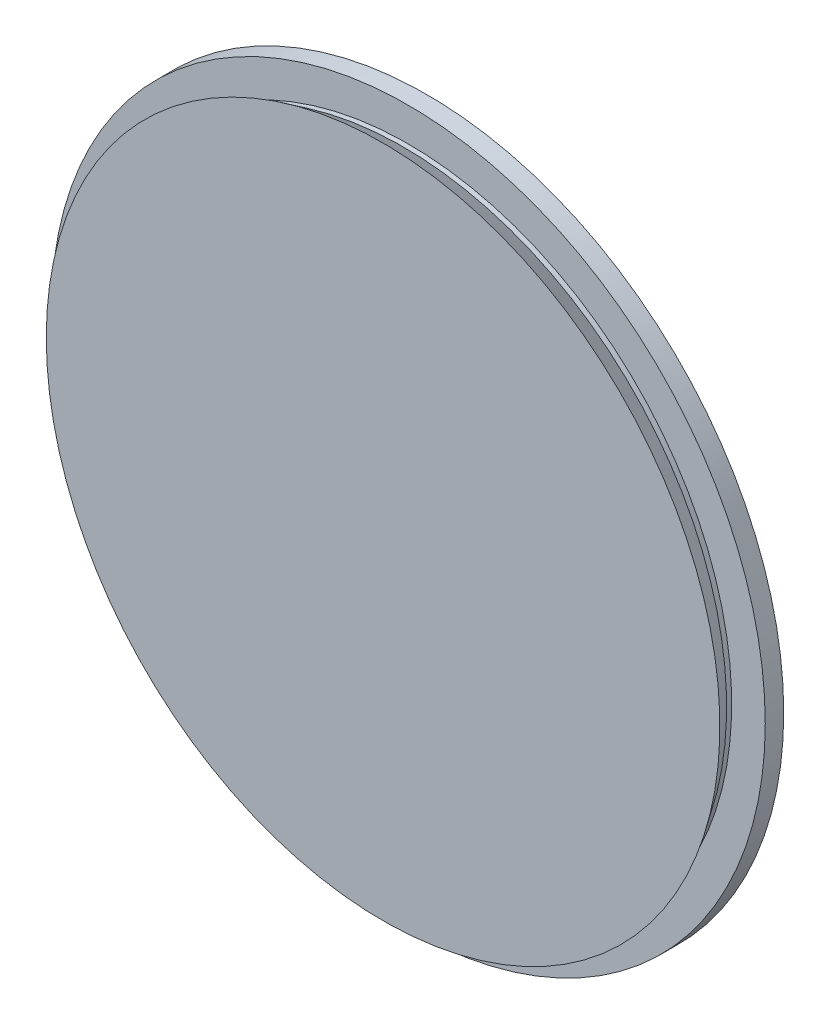
from build123d import *

# Parameters (mm, degrees)
SKETCH1_R           = 19.25
BOSS_EXTRUDE1_DEPTH = 2.6
SKETCH2_R           = 21.25
SKETCH2_R_2         = 19.25
BOSS_EXTRUDE2_DEPTH = 1.1


with BuildPart() as part:
    # Sketch1 → Boss-Extrude1 (new body)
    with BuildSketch(Plane.XY):
        Circle(SKETCH1_R)
    extrude(amount=BOSS_EXTRUDE1_DEPTH)

    # Sketch2 → Boss-Extrude2 (add)
    with BuildSketch(Plane(origin=(0, 0, 0), x_dir=(-1, 0, 0), z_dir=(0, 0, -1))):
        Circle(SKETCH2_R)
        Circle(SKETCH2_R_2, mode=Mode.SUBTRACT)
    extrude(amount=-BOSS_EXTRUDE2_DEPTH)

    # Sweep1: sweep along a path in Sketch4
    with BuildLine(Plane.XY.offset(2.6)) as sweep1_path:
        CenterArc((0, 0), 19.25, 0, 360)
    # Sketch3 → Sweep1 (sweep)
    with BuildSketch(Plane(origin=(0, 0, 0), x_dir=(1, 0, 0), z_dir=(0, 1, 0))):
        Polygon((-19.25, -1.4), (-20.05, -2.6), (-19.25, -2.6), align=None)
    sweep(path=sweep1_path.line)


solid = part.part
